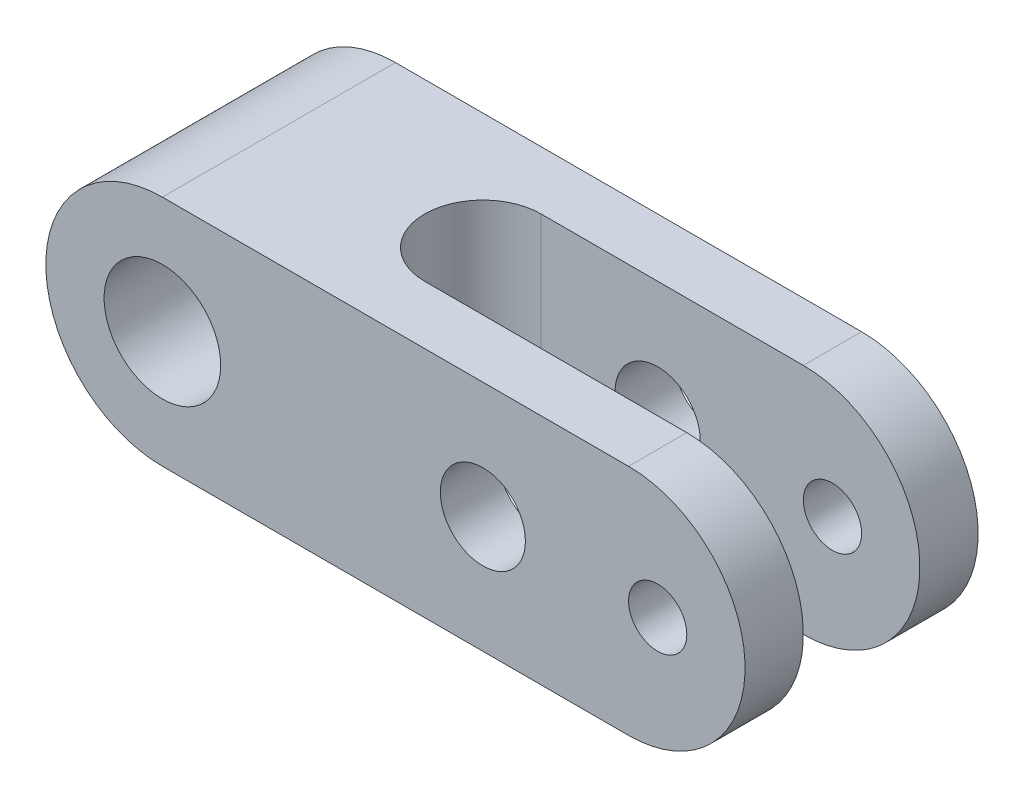
from build123d import *

# Parameters (mm, degrees)
BOSS_EXTRUDE1_DEPTH = 12.7
SKETCH2_R           = 3.175
SKETCH2_R_2         = 4.6355
SKETCH2_R_3         = 6.35
CUT_EXTRUDE1_DEPTH  = 25.4
SKETCH3_W           = 47.625
SKETCH3_H           = 12.7
CUT_EXTRUDE2_DEPTH  = 25.4
FILLET1_R           = 6.35


with BuildPart() as part:
    # Sketch1 → Boss-Extrude1 (new, symmetric)
    with BuildSketch(Plane.XY):
        with BuildLine():
            Line((-25.4, 12.7), (25.4, 12.7))
            ThreePointArc((25.4, 12.7), (38.1, 0), (25.4, -12.7))
            Line((25.4, -12.7), (-25.4, -12.7))
            ThreePointArc((-25.4, -12.7), (-38.1, 0), (-25.4, 12.7))
        make_face()
    extrude(amount=BOSS_EXTRUDE1_DEPTH, both=True)

    # Sketch2 → Cut-Extrude1 (cut)
    with BuildSketch(Plane.XY.offset(12.7)):
        with Locations((28.575, 0)):
            Circle(SKETCH2_R)
        with Locations((9.525, 0)):
            Circle(SKETCH2_R_2)
        with Locations((-25.4, 0)):
            Circle(SKETCH2_R_3)
    extrude(amount=-CUT_EXTRUDE1_DEPTH, mode=Mode.SUBTRACT)

    # Sketch3 → Cut-Extrude2 (cut)
    with BuildSketch(Plane(origin=(0, 12.7, 0), x_dir=(1, 0, 0), z_dir=(0, 1, 0))):
        with Locations((14.2875, 0)):
            Rectangle(SKETCH3_W, SKETCH3_H)
    extrude(amount=-CUT_EXTRUDE2_DEPTH, mode=Mode.SUBTRACT)

    # Fillet1
    fillet1_edges = [part.edges().sort_by_distance(p)[0] for p in [
        (-9.525, 0, -6.35),
        (-9.525, 0, 6.35),
    ]]
    fillet(fillet1_edges, radius=FILLET1_R - 0.0001)  # a hair under: the kernel refuses the full size


solid = part.part
